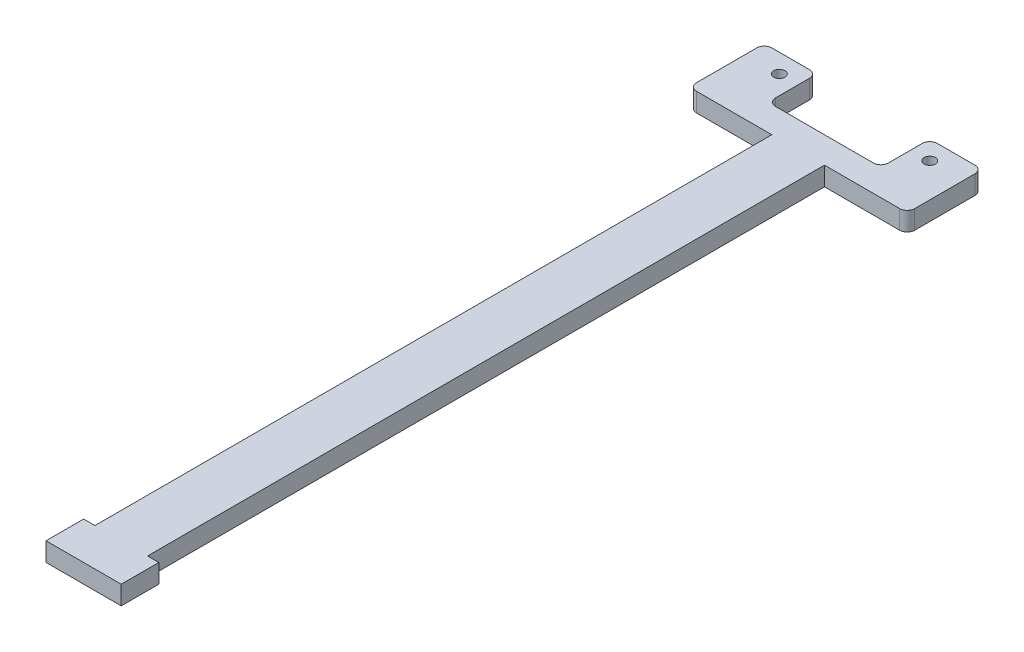
from build123d import *

# Parameters (mm, degrees)
BOSS_EXTRUDE1_DEPTH = 5
SKETCH2_R           = 1.5
SKETCH2_W           = 30
SKETCH2_H           = 13
CUT_EXTRUDE1_DEPTH  = 10
FILLET1_R           = 2


with BuildPart() as part:
    # Sketch1 → Boss-Extrude1 (new body)
    with BuildSketch(Plane(origin=(0, 0, 0), x_dir=(1, 0, 0), z_dir=(0, 1, 0))):
        Polygon((9, -10), (9, 0), (6, 0), (6, 180), (28, 180), (28, 200), (-30, 200), (-30, 180), (-8, 180), (-8, 0), (-11, 0), (-11, -10), align=None)
    extrude(amount=BOSS_EXTRUDE1_DEPTH)

    # Sketch2 → Cut-Extrude1 (cut)
    with BuildSketch(Plane(origin=(0, 5, 0), x_dir=(1, 0, 0), z_dir=(0, 1, 0))):
        with Locations((-21, 195)):
            Circle(SKETCH2_R)
        with Locations((19, 195)):
            Circle(SKETCH2_R)
        with Locations((-1, 193.5)):
            Rectangle(SKETCH2_W, SKETCH2_H)
    extrude(amount=-CUT_EXTRUDE1_DEPTH, mode=Mode.SUBTRACT)

    # Fillet1
    fillet1_edges = [part.edges().sort_by_distance(p)[0] for p in [
        (28, 2.5, -180),
        (28, 2.5, -200),
        (-30, 2.5, -180),
        (-30, 2.5, -200),
        (14, 2.5, -187),
        (14, 2.5, -200),
        (-16, 2.5, -187),
        (-16, 2.5, -200),
    ]]
    fillet(fillet1_edges, radius=FILLET1_R)


solid = part.part
